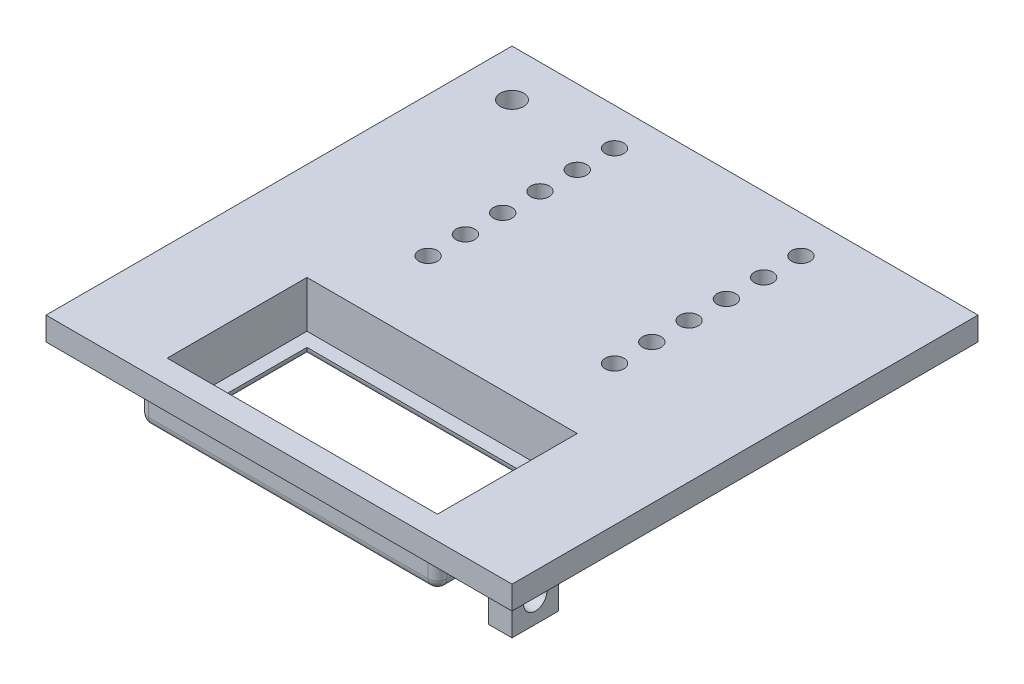
from build123d import *

# Parameters (mm, degrees)
SKETCH1_W           = 100
SKETCH1_H           = 100
SKETCH1_R           = 2
SKETCH1_W_2         = 58
SKETCH1_H_2         = 30
BOSS_EXTRUDE1_DEPTH = 5
SKETCH2_W           = 64
SKETCH2_H           = 36
SKETCH2_W_2         = 58
SKETCH2_H_2         = 30
BOSS_EXTRUDE2_DEPTH = 5
SKETCH3_W           = 64
SKETCH3_H           = 36
SKETCH3_W_2         = 52
SKETCH3_H_2         = 24
BOSS_EXTRUDE3_DEPTH = 2
FILLET2_R           = 2
SKETCH5_W           = 5
SKETCH5_H           = 10
BOSS_EXTRUDE4_DEPTH = 10
SKETCH6_R           = 2.5
CUT_EXTRUDE2_DEPTH  = 8
SKETCH7_R           = 2.5
CUT_EXTRUDE3_DEPTH  = 8


with BuildPart() as part:
    # Sketch1 → Boss-Extrude1 (new body)
    with BuildSketch(Plane(origin=(0, 0, 0), x_dir=(1, 0, 0), z_dir=(0, 1, 0))):
        with Locations((23.538461538, -26.998952175)):
            Rectangle(SKETCH1_W, SKETCH1_H)
        with Locations(Location((3.538461538, 15.001047825, 0), (0, 0, 270))):
            Circle(SKETCH1_R, mode=Mode.SUBTRACT)
        with Locations(Location((3.538461538, 7.001047825, 0), (0, 0, 270))):
            Circle(SKETCH1_R, mode=Mode.SUBTRACT)
        with Locations(Location((3.538461538, -0.998952175, 0), (0, 0, 270))):
            Circle(SKETCH1_R, mode=Mode.SUBTRACT)
        with Locations(Location((3.538461538, -8.998952175, 0), (0, 0, 270))):
            Circle(SKETCH1_R, mode=Mode.SUBTRACT)
        with Locations(Location((3.538461538, -16.998952175, 0), (0, 0, 270))):
            Circle(SKETCH1_R, mode=Mode.SUBTRACT)
        with Locations(Location((3.538461538, -24.998952175, 0), (0, 0, 270))):
            Circle(SKETCH1_R, mode=Mode.SUBTRACT)
        with Locations(Location((43.538461538, -24.998952175, 0), (0, 0, 90))):
            Circle(SKETCH1_R, mode=Mode.SUBTRACT)
        with Locations(Location((43.538461538, -16.998952175, 0), (0, 0, 90))):
            Circle(SKETCH1_R, mode=Mode.SUBTRACT)
        with Locations(Location((43.538461538, -8.998952175, 0), (0, 0, 90))):
            Circle(SKETCH1_R, mode=Mode.SUBTRACT)
        with Locations(Location((43.538461538, -0.998952175, 0), (0, 0, 90))):
            Circle(SKETCH1_R, mode=Mode.SUBTRACT)
        with Locations(Location((43.538461538, 7.001047825, 0), (0, 0, 90))):
            Circle(SKETCH1_R, mode=Mode.SUBTRACT)
        with Locations(Location((43.538461538, 15.001047825, 0), (0, 0, 90))):
            Circle(SKETCH1_R, mode=Mode.SUBTRACT)
        with Locations((23.538461538, -56.998952175)):
            Rectangle(SKETCH1_W_2, SKETCH1_H_2, mode=Mode.SUBTRACT)
    extrude(amount=BOSS_EXTRUDE1_DEPTH)

    # Sketch2 → Boss-Extrude2 (add)
    with BuildSketch(Plane.XZ):
        with Locations((23.538461538, 56.998952175)):
            Rectangle(SKETCH2_W, SKETCH2_H)
        with Locations((23.538461538, 56.998952175)):
            Rectangle(SKETCH2_W_2, SKETCH2_H_2, mode=Mode.SUBTRACT)
    extrude(amount=BOSS_EXTRUDE2_DEPTH)

    # Sketch3 → Boss-Extrude3 (add)
    with BuildSketch(Plane.XZ.offset(5)):
        with Locations((23.538461538, 56.998952175)):
            Rectangle(SKETCH3_W, SKETCH3_H)
        with Locations((23.538461538, 56.998952175)):
            Rectangle(SKETCH3_W_2, SKETCH3_H_2, mode=Mode.SUBTRACT)
    extrude(amount=BOSS_EXTRUDE3_DEPTH)

    # Fillet2
    fillet2_edges = [part.edges().sort_by_distance(p)[0] for p in [
        (49.538461538, -7, 56.998952175),
        (23.538461538, -7, 68.998952175),
        (-2.461538462, -7, 56.998952175),
        (23.538461538, -7, 44.998952175),
        (23.538461538, -7, 74.998952175),
        (55.538461538, -7, 56.998952175),
        (23.538461538, -7, 38.998952175),
        (-8.461538462, -7, 56.998952175),
        (-8.461538462, -3.5, 38.998952175),
        (55.538461538, -3.5, 38.998952175),
        (55.538461538, -3.5, 74.998952175),
        (-8.461538462, -3.5, 74.998952175),
        (-8.461538462, 0, 56.998952175),
        (23.538461538, 0, 74.998952175),
        (55.538461538, 0, 56.998952175),
        (23.538461538, 0, 38.998952175),
    ]]
    fillet(fillet2_edges, radius=FILLET2_R - 0.0001)  # a hair under: the kernel refuses the full size

    # Sketch5 → Boss-Extrude4 (add)
    with BuildSketch(Plane.XZ):
        with Locations((66.038461538, 66.998952175)):
            Rectangle(SKETCH5_W, SKETCH5_H)
    extrude(amount=BOSS_EXTRUDE4_DEPTH)

    # Sketch6 → Cut-Extrude2 (cut)
    with BuildSketch(Plane(origin=(68.538461538, 0, 0), x_dir=(0, 0, -1), z_dir=(1, 0, 0))):
        with Locations((-66.998952175, -5)):
            Circle(SKETCH6_R)
    extrude(amount=-CUT_EXTRUDE2_DEPTH, mode=Mode.SUBTRACT)

    # Sketch7 → Cut-Extrude3 (cut)
    with BuildSketch(Plane.XZ):
        with Locations(Location((-16.461538462, -13.001047825, 0), (0, 0, 270))):
            Circle(SKETCH7_R)
    extrude(amount=-CUT_EXTRUDE3_DEPTH, mode=Mode.SUBTRACT)


solid = part.part
